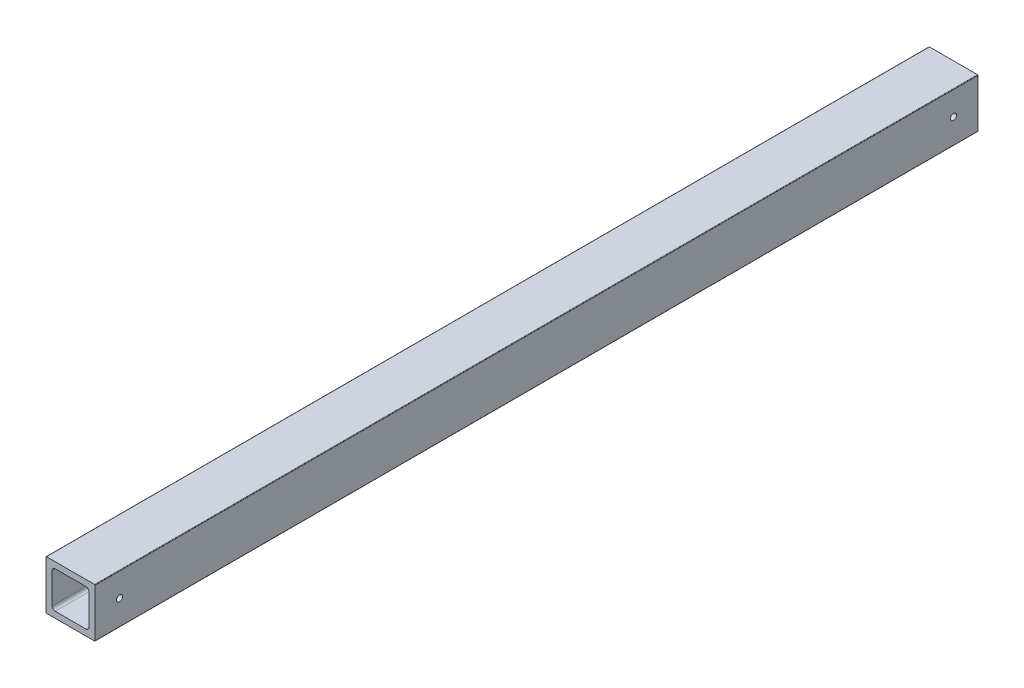
from build123d import *

# Parameters (mm, degrees)
BOSS_EXTRUDE1_DEPTH = 457.2
SKETCH2_R           = 1.5875
CUT_EXTRUDE1_DEPTH  = 459.608940166


with BuildPart() as part:
    # Sketch1 → Boss-Extrude1 (new body)
    with BuildSketch(Plane(origin=(0, 0, 0), x_dir=(-1, 0, 0), z_dir=(0, 0, -1))):
        with BuildLine():
            Line((0, 0.254), (0, 25.146))
            ThreePointArc((0, 25.146), (-0.074394878, 25.325605122), (-0.254, 25.4))
            Line((-0.254, 25.4), (-25.146, 25.4))
            ThreePointArc((-25.146, 25.4), (-25.325605122, 25.325605122), (-25.4, 25.146))
            Line((-25.4, 25.146), (-25.4, 0.254))
            ThreePointArc((-25.4, 0.254), (-25.325605122, 0.074394878), (-25.146, 0))
            Line((-25.146, 0), (-0.254, 0))
            ThreePointArc((-0.254, 0), (-0.074394878, 0.074394878), (0, 0.254))
        make_face()
        with BuildLine():
            Line((-3.175, 20.6375), (-3.175, 4.7625))
            ThreePointArc((-3.175, 4.7625), (-3.639967985, 3.639967985), (-4.7625, 3.175))
            Line((-4.7625, 3.175), (-20.6375, 3.175))
            ThreePointArc((-20.6375, 3.175), (-21.760032015, 3.639967985), (-22.225, 4.7625))
            Line((-22.225, 4.7625), (-22.225, 20.6375))
            ThreePointArc((-22.225, 20.6375), (-21.760032015, 21.760032015), (-20.6375, 22.225))
            Line((-20.6375, 22.225), (-4.7625, 22.225))
            ThreePointArc((-4.7625, 22.225), (-3.639967985, 21.760032015), (-3.175, 20.6375))
        make_face(mode=Mode.SUBTRACT)
    extrude(amount=-BOSS_EXTRUDE1_DEPTH)

    # Sketch2 → Cut-Extrude1 (cut, through all)
    with BuildSketch(Plane.ZY):
        with Locations((12.697459746, 12.954)):
            Circle(SKETCH2_R)
        with Locations((444.5, 12.954)):
            Circle(SKETCH2_R)
    extrude(amount=-CUT_EXTRUDE1_DEPTH, mode=Mode.SUBTRACT)


solid = part.part
